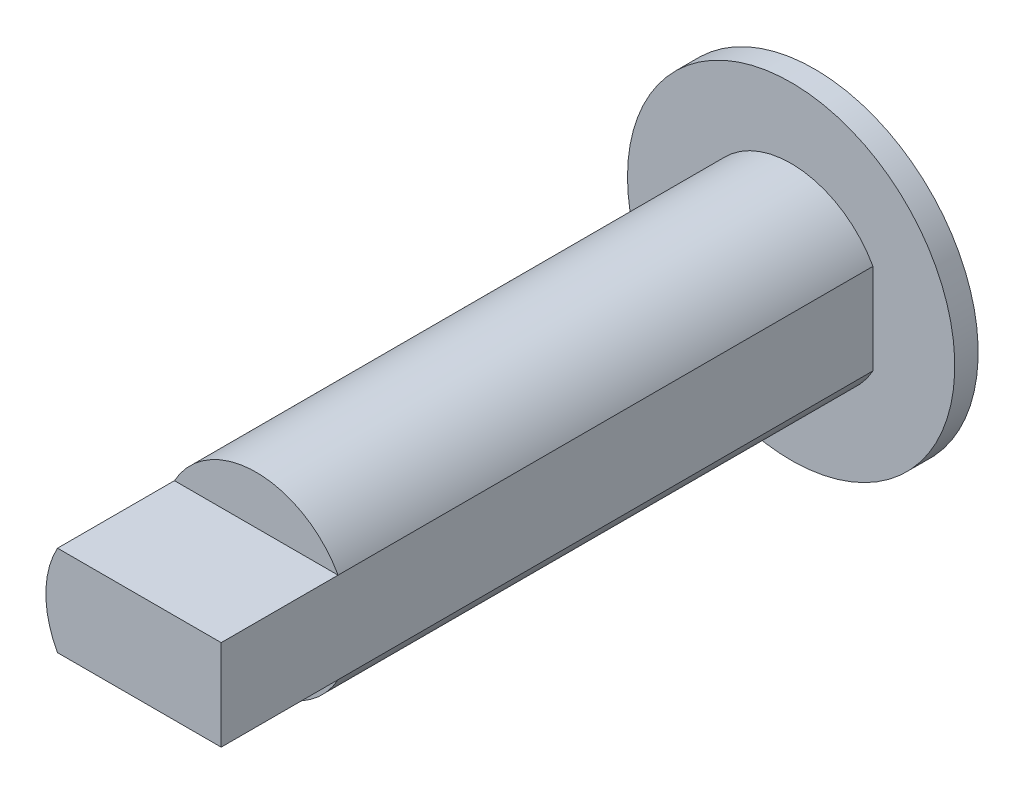
from build123d import *

# Parameters (mm, degrees)
BOSS_EXTRUDE1_DEPTH = 27.8796339
CUT_EXTRUDE1_DEPTH  = 5
SKETCH3_R           = 7
BOSS_EXTRUDE2_DEPTH = 1


with BuildPart() as part:
    # Sketch1 → Boss-Extrude1 (new body)
    with BuildSketch(Plane.XY):
        with BuildLine():
            Line((3.5, 1.936491673), (3.5, -1.936491673))
            ThreePointArc((3.5, -1.936491673), (-4, 0), (3.5, 1.936491673))
        make_face()
    extrude(amount=-BOSS_EXTRUDE1_DEPTH)

    # Sketch2 → Cut-Extrude1 (cut)
    with BuildSketch(Plane.XY):
        with BuildLine():
            Line((3.5, 1.936491673), (-3.5, 1.936491673))
            ThreePointArc((-3.5, 1.936491673), (0, 4), (3.5, 1.936491673))
        make_face()
        with BuildLine():
            Line((3.5, -1.936491673), (-3.5, -1.936491673))
            ThreePointArc((-3.5, -1.936491673), (0, -4), (3.5, -1.936491673))
        make_face()
    extrude(amount=-CUT_EXTRUDE1_DEPTH, mode=Mode.SUBTRACT)

    # Sketch3 → Boss-Extrude2 (add)
    with BuildSketch(Plane(origin=(0, 0, -27.8796339), x_dir=(-1, 0, 0), z_dir=(0, 0, -1))):
        Circle(SKETCH3_R)
    extrude(amount=BOSS_EXTRUDE2_DEPTH)


solid = part.part
